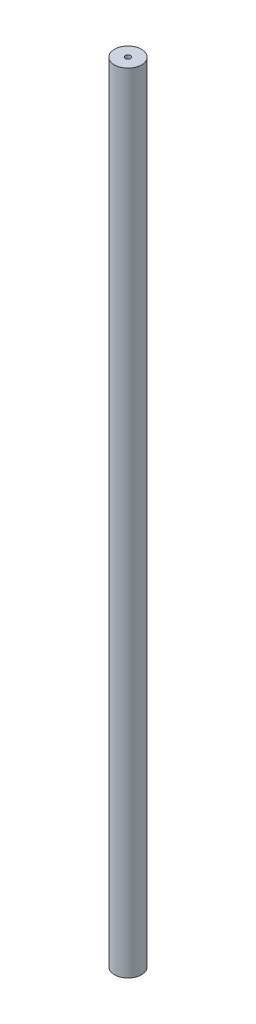
from build123d import *

# Parameters (mm, degrees)
SKETCH1_R           = 12.7
SKETCH1_R_2         = 2.5
BOSS_EXTRUDE1_DEPTH = 738


with BuildPart() as part:
    # Sketch1 → Boss-Extrude1 (new body)
    with BuildSketch(Plane(origin=(0, 0, 0), x_dir=(1, 0, 0), z_dir=(0, 1, 0))):
        Circle(SKETCH1_R)
        Circle(SKETCH1_R_2, mode=Mode.SUBTRACT)
    extrude(amount=BOSS_EXTRUDE1_DEPTH)


solid = part.part
